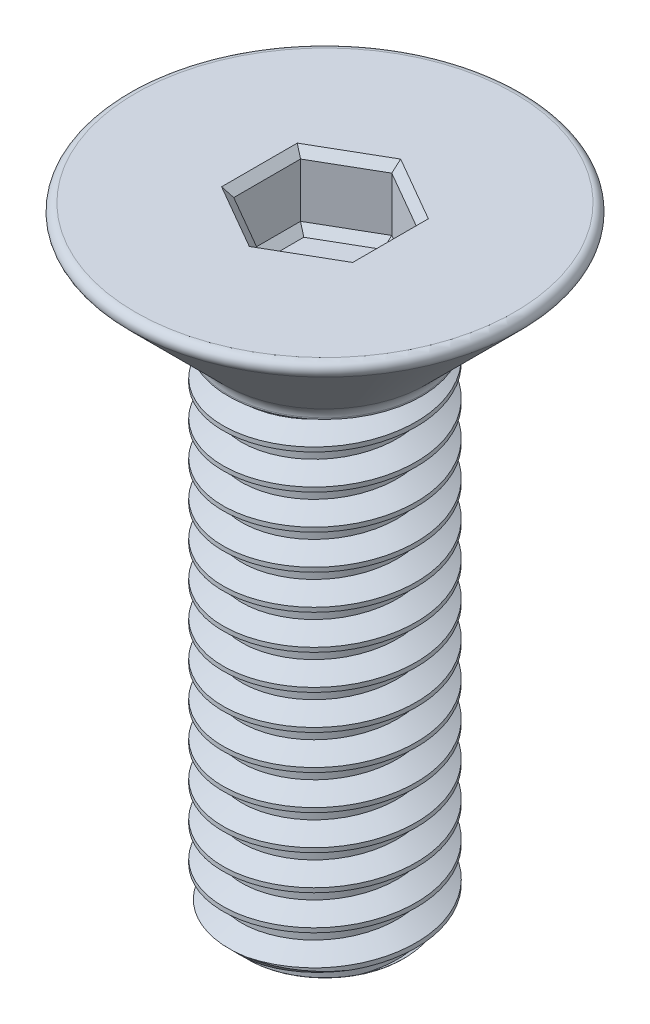
from build123d import *

# Parameters (mm, degrees)
SKETCH1_R           = 1.25
BOSS_EXTRUDE1_DEPTH = 6.45
THREAD1_PITCH       = 0.45
SKETCH5_R           = 1.25
BOSS_EXTRUDE2_DEPTH = 0.1
SKETCH6_R           = 1.25
BOSS_EXTRUDE3_DEPTH = 1.45
BOSS_EXTRUDE3_DRAFT = -45
FILLET1_R           = 0.2
FILLET2_R           = 0.1
CUT_EXTRUDE1_DEPTH  = 0.8
CHAMFER1_SIZE       = 0.1
CUT_EXTRUDE2_DEPTH  = 0.1
CUT_EXTRUDE2_DRAFT  = -45


with BuildPart() as part:
    # Sketch1 → Boss-Extrude1 (new body)
    with BuildSketch(Plane(origin=(0, 0, 0), x_dir=(1, 0, 0), z_dir=(0, 1, 0))):
        with Locations(Location((0, 0, 0), (0, 0, 90))):
            Circle(SKETCH1_R)
    extrude(amount=BOSS_EXTRUDE1_DEPTH)

    # Thread1: arcs per turn and ends read off the stored shape
    # Thread1: the profile of Thread Profile1 profile screwed along a right-hand helix through 18.777775 turns, 6 arcs to a turn; built about Z, then put on its axis
    thread1_z = Axis((0, 0, 0), (0, 0, 1))
    thread1_corners = [(1.2503, 0, -0.000173205), (1.2503, 0, 0.393923204), (1.006430356, 0, 0.253124999), (1.006430356, 0, 0.140624999)]
    with BuildLine(mode=Mode.PRIVATE) as thread1_profile:
        Line(thread1_corners[0], thread1_corners[1])
        Line(thread1_corners[1], thread1_corners[2])
        Line(thread1_corners[2], thread1_corners[3])
        Line(thread1_corners[3], thread1_corners[0])
    thread1_cap = Face(thread1_profile.wire())
    thread1_turn_angles = [0, 30, 60, 90, 120, 150, 180, 210, 240, 270, 300, 330, 360]
    thread1_turn_weights = [1, 0.8660254037844387, 1, 0.8660254037844387, 1, 0.8660254037844387, 1, 0.8660254037844387, 1, 0.8660254037844387, 1, 0.8660254037844387, 1]
    thread1_turn_rails = [Edge.make_bspline([Vector(p[0], p[1], 0).rotate(thread1_z, thread1_turn_angles[k]) / thread1_turn_weights[k] + Vector(0, 0, p[2] + THREAD1_PITCH * thread1_turn_angles[k] / 360) for k in range(13)], [0, 0, 0, 1, 1, 2, 2, 3, 3, 4, 4, 5, 5, 6, 6, 6], 2, thread1_turn_weights) for p in thread1_corners]
    thread1_turn_sides = [Face.make_surface_from_curves(thread1_turn_rails[p[0]], thread1_turn_rails[p[1]]) for p in [(0, 1), (1, 2), (2, 3), (3, 0)]]
    thread1_last_angles = [6480, 6510, 6540, 6570, 6600, 6630, 6660, 6690, 6720, 6739.9995, 6759.999]
    thread1_last_weights = [1, 0.8660254037844387, 1, 0.8660254037844387, 1, 0.8660254037844387, 1, 0.8660254037844387, 1, 0.9396956054389327, 1]
    thread1_last_rails = [Edge.make_bspline([Vector(p[0], p[1], 0).rotate(thread1_z, thread1_last_angles[k]) / thread1_last_weights[k] + Vector(0, 0, p[2] + THREAD1_PITCH * thread1_last_angles[k] / 360) for k in range(11)], [0, 0, 0, 1, 1, 2, 2, 3, 3, 4, 4, 5, 5, 5], 2, thread1_last_weights) for p in thread1_corners]
    thread1_last_sides = [Face.make_surface_from_curves(thread1_last_rails[p[0]], thread1_last_rails[p[1]]) for p in [(0, 1), (1, 2), (2, 3), (3, 0)]]
    thread1 = Plane(origin=(0, -1, 0), x_dir=(1, 0, 0), z_dir=(0, 1, 0)) * Solid(Shell([*[p.moved(Location((0, 0, THREAD1_PITCH * i))) for i in range(18) for p in thread1_turn_sides], *thread1_last_sides, thread1_cap, thread1_cap.rotate(thread1_z, 6759.999).moved(Location((0, 0, THREAD1_PITCH * 6759.999 / 360)))]))
    add(thread1, mode=Mode.SUBTRACT)

    # Sketch5 → Boss-Extrude2 (add)
    with BuildSketch(Plane(origin=(0, 6.45, 0), x_dir=(1, 0, 0), z_dir=(0, 1, 0))):
        with Locations(Location((0, 0, 0), (0, 0, 80.405931773))):
            Circle(SKETCH5_R)
    extrude(amount=BOSS_EXTRUDE2_DEPTH)


with BuildPart() as boss_extrude3_tool:
    # Sketch6 → Boss-Extrude3 (with draft: the straight prism first)
    with BuildSketch(Plane(origin=(0, 6.55, 0), x_dir=(1, 0, 0), z_dir=(0, 1, 0))):
        with Locations(Location((0, 0, 0), (0, 0, 80.405931773))):
            Circle(SKETCH6_R)
    extrude(amount=BOSS_EXTRUDE3_DEPTH)
    # Boss-Extrude3: the draft: its side faces are tilted about the plane it starts from
    boss_extrude3_sides = [boss_extrude3_tool.faces().sort_by_distance(p)[0] for p in [
        (-0.208333333, 7.275, 1.232516621),
    ]]
    draft(boss_extrude3_sides, Plane(origin=(0, 6.55, 0), x_dir=(1, 0, 0), z_dir=(0, 1, 0)), BOSS_EXTRUDE3_DRAFT)


with BuildPart() as part_1:
    add(part.part)

    # Boss-Extrude3: add boss_extrude3_tool
    add(boss_extrude3_tool.part)

    # Fillet1
    fillet1_edges = [part_1.edges().sort_by_distance(p)[0] for p in [
        (-0.208333333, 6.55, 1.232516621),
    ]]
    fillet(fillet1_edges, radius=FILLET1_R)

    # Fillet2
    fillet2_edges = [part_1.edges().sort_by_distance(p)[0] for p in [
        (-0.45, 8, 2.662235902),
    ]]
    fillet(fillet2_edges, radius=FILLET2_R)

    # Sketch7 → Cut-Revolve1 (revolve, cut)
    with BuildSketch(Plane.XY, mode=Mode.PRIVATE) as cut_revolve1_sk:
        Polygon((1.26, 0), (1.26, 0.26), (1, 0), align=None)
    revolve(cut_revolve1_sk.sketch.rotate(Axis((0, 0, 0), (0, 1, 0)), 200.405931773), axis=Axis((0, 0, 0), (0, 1, 0)), mode=Mode.SUBTRACT)

    # Sketch8 → Cut-Extrude1 (cut)
    with BuildSketch(Plane(origin=(0, 8, 0), x_dir=(1, 0, 0), z_dir=(0, 1, 0))):
        Polygon((0, 0.866025404), (-0.75, 0.433012702), (-0.75, -0.433012702), (0, -0.866025404), (0.75, -0.433012702), (0.75, 0.433012702), align=None)
    extrude(amount=-CUT_EXTRUDE1_DEPTH, mode=Mode.SUBTRACT)

    # Chamfer1
    chamfer1_edges = [part_1.edges().sort_by_distance(p)[0] for p in [
        (0.375, 8, -0.649519053),
        (-0.375, 8, -0.649519053),
        (-0.75, 8, 0),
        (-0.375, 8, 0.649519053),
        (0.375, 8, 0.649519053),
        (0.75, 8, 0),
    ]]
    chamfer(chamfer1_edges, length=CHAMFER1_SIZE)


with BuildPart() as cut_extrude2_tool:
    # Sketch9 → Cut-Extrude2 (with draft: the straight prism first)
    with BuildSketch(Plane(origin=(0, 7.2, 0), x_dir=(1, 0, 0), z_dir=(0, 1, 0))):
        Polygon((0, 0.866025404), (-0.75, 0.433012702), (-0.75, -0.433012702), (0, -0.866025404), (0.75, -0.433012702), (0.75, 0.433012702), align=None)
    extrude(amount=-CUT_EXTRUDE2_DEPTH)
    # Cut-Extrude2: the draft: its side faces are tilted about the plane it starts from
    cut_extrude2_sides = [cut_extrude2_tool.faces().sort_by_distance(p)[0] for p in [
        (-0.375, 7.15, -0.649519053),
        (-0.75, 7.15, 0),
        (-0.375, 7.15, 0.649519053),
        (0.375, 7.15, 0.649519053),
        (0.75, 7.15, 0),
        (0.375, 7.15, -0.649519053),
    ]]
    draft(cut_extrude2_sides, Plane(origin=(0, 7.2, 0), x_dir=(1, 0, 0), z_dir=(0, 1, 0)), CUT_EXTRUDE2_DRAFT)


with BuildPart() as part_2:
    add(part_1.part)

    # Cut-Extrude2: cut by cut_extrude2_tool
    add(cut_extrude2_tool.part, mode=Mode.SUBTRACT)


solid = part_2.part
